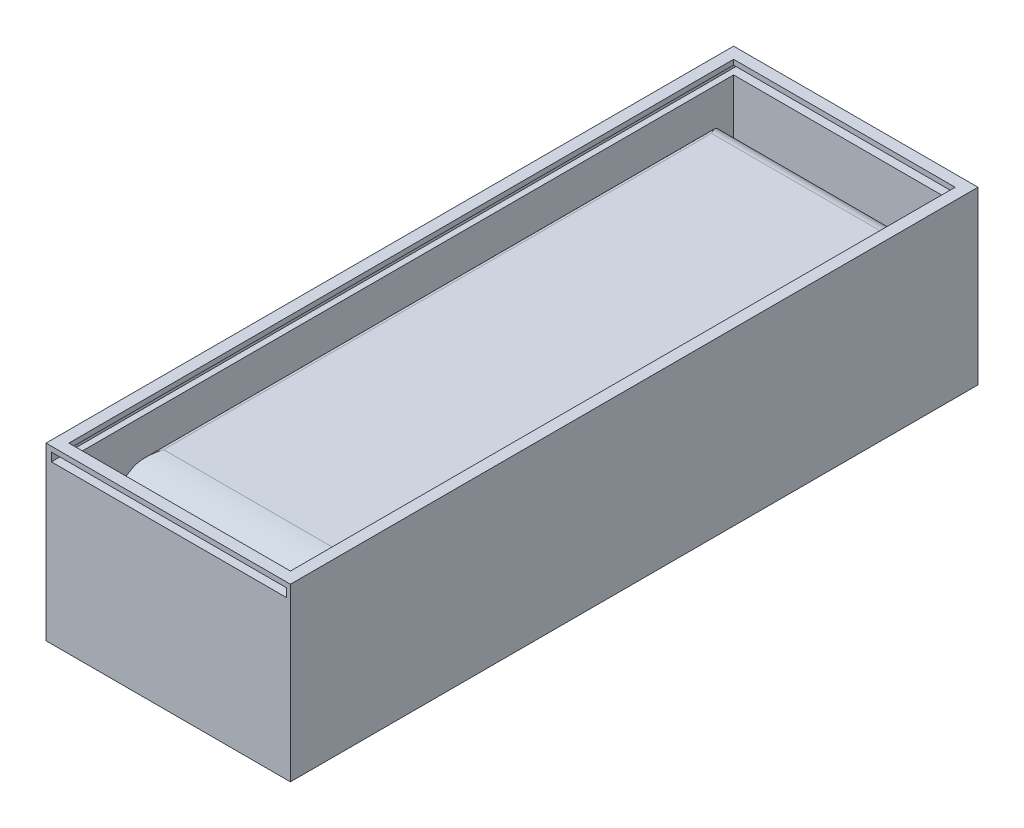
from build123d import *
from OCP.BRepFilletAPI import BRepFilletAPI_MakeFillet

# Parameters (mm, degrees)
SKETCH1_W                  = 34
SKETCH1_H                  = 24
BOSS_EXTRUDE1_DEPTH        = 109
FILLET1_R1                 = 3
FILLET1_R2                 = 1
FILLET1_R3                 = 10
SURFACE_EXTRUSION1_1_BACK  = 30
SURFACE_EXTRUSION1_1_DEPTH = 30
EPAISSIR1_T1               = 2
EPAISSIR2_START            = -4.183446705
EPAISSIR2_OUTLINE_W        = 38.83303867
EPAISSIR2_OUTLINE_H        = 2
EPAISSIR2_DEPTH            = 116.499116009
ESQUISSE3_W                = 41.210599086
ESQUISSE3_H                = 1.486783871
ENL_V_MAT_EXTRU_1_DEPTH    = 120


# Read off the part's stored shape, not the designer's step: Epaissir2
with BuildPart() as part:
    # Sketch1 → Boss-Extrude1 (new body)
    with BuildSketch(Plane.XY):
        Rectangle(SKETCH1_W, SKETCH1_H)
    extrude(amount=BOSS_EXTRUDE1_DEPTH)

    # Fillet1: one fillet with a radius per group of edges: ONE call of the kernel's fillet builder (fillet() takes one radius for all edges)
    fillet1_edges_1 = [part.edges().sort_by_distance(p)[0] for p in [
        (0, 12, 0),
        (0, -12, 0),
    ]]
    fillet1_edges_2 = [part.edges().sort_by_distance(p)[0] for p in [
        (17, 12, 54.5),
        (-17, 12, 54.5),
        (17, -12, 54.5),
        (-17, -12, 54.5),
    ]]
    fillet1_edges_3 = [part.edges().sort_by_distance(p)[0] for p in [
        (0, 12, 109),
        (0, -12, 109),
    ]]
    fillet1 = BRepFilletAPI_MakeFillet(part.part.solid().wrapped)
    for e in fillet1_edges_1:
        fillet1.Add(FILLET1_R1, e.wrapped)
    for e in fillet1_edges_2:
        fillet1.Add(FILLET1_R2, e.wrapped)
    for e in fillet1_edges_3:
        fillet1.Add(FILLET1_R3, e.wrapped)
    add(Compound.cast(fillet1.Shape()), mode=Mode.REPLACE)



with BuildPart() as body_2:
    # Surface-Extrusion1: a surface, the sketch's curves swept straight by 30 mm
    with BuildLine(Plane.XZ.offset(12).offset(-SURFACE_EXTRUSION1_1_BACK), mode=Mode.PRIVATE) as surface_extrusion1_1_path:
        Line((-19.30804716, 112.315669304), (19.52499151, 112.315669304))
        Line((19.52499151, 112.315669304), (19.52499151, -4.183446705))
        Line((19.52499151, -4.183446705), (-19.30804716, -4.183446705))
        Line((-19.30804716, -4.183446705), (-19.30804716, 112.315669304))
    surface_extrusion1_1 = Shell.extrude(surface_extrusion1_1_path.wire(), (0 * SURFACE_EXTRUSION1_1_DEPTH, -1 * SURFACE_EXTRUSION1_1_DEPTH, 0 * SURFACE_EXTRUSION1_1_DEPTH))
    add(Solid.thicken(surface_extrusion1_1, EPAISSIR1_T1))


with BuildPart() as part_1:
    add(part.part)

    add(body_2.part)  # Epaissir2 merges body 2
    # Epaissir2 outline → Epaissir2 (add)
    with BuildSketch(Plane.XY.offset(EPAISSIR2_START)):
        with Locations((0.108472175, -13)):
            Rectangle(EPAISSIR2_OUTLINE_W, EPAISSIR2_OUTLINE_H)
    extrude(amount=EPAISSIR2_DEPTH)

    # Esquisse3 → Enlèv. mat.-Extru.1 (cut)
    with BuildSketch(Plane.XY.offset(114.315669304)):
        with Locations((0.241901497, 16.372244085)):
            Rectangle(ESQUISSE3_W, ESQUISSE3_H)
    extrude(amount=-ENL_V_MAT_EXTRU_1_DEPTH, mode=Mode.SUBTRACT)


solid = part_1.part
